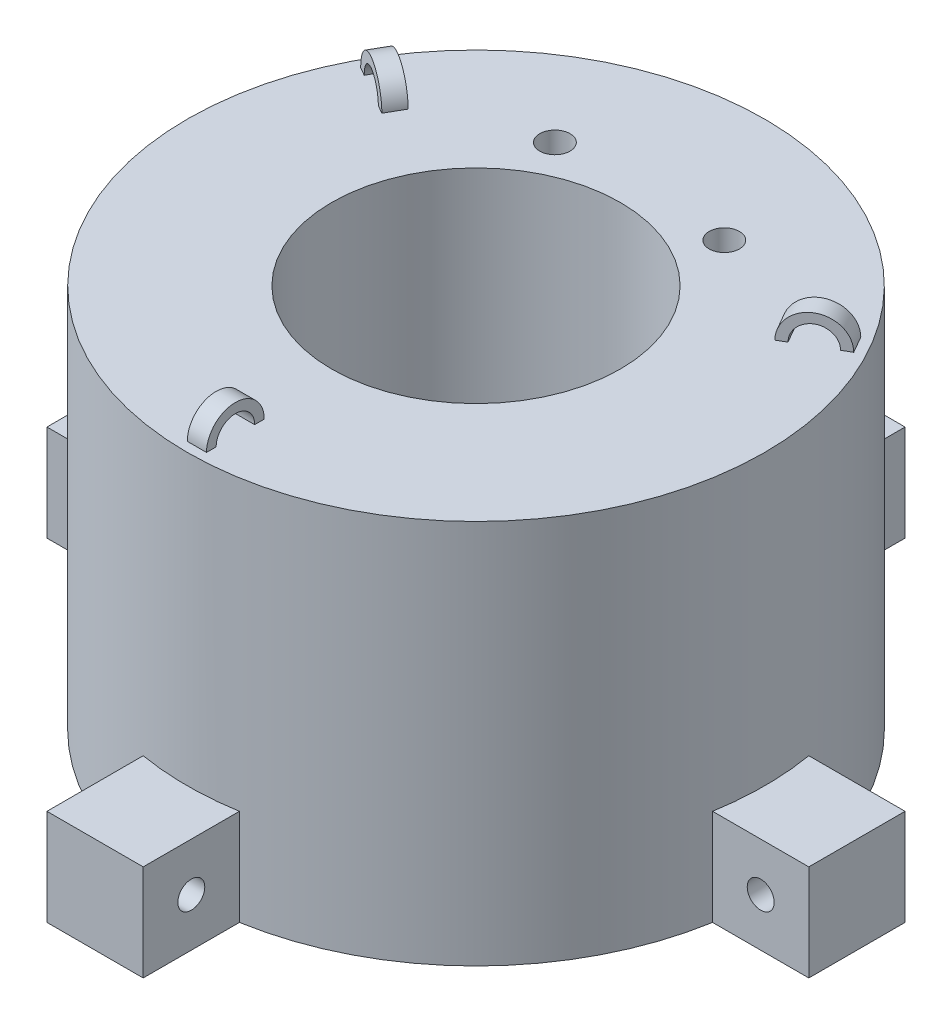
from build123d import *

# Parameters (mm, degrees)
SKETCH2_R           = 38.1
BOSS_EXTRUDE1_DEPTH = 50.8
SKETCH3_R           = 19.05
CUT_EXTRUDE1_DEPTH  = 76.2
BOSS_EXTRUDE2_DEPTH = 12.7
SKETCH5_R           = 1.778
CUT_EXTRUDE2_DEPTH  = 25.4
CIRPATTERN2_COUNT   = 4
SKETCH10_R          = 2
CUT_EXTRUDE4_DEPTH  = 12.7
BOSS_EXTRUDE5_DEPTH = 1.27
CIRPATTERN3_COUNT   = 3


with BuildPart() as part:
    # Sketch2 → Boss-Extrude1 (new body)
    with BuildSketch(Plane(origin=(0, 0, 0), x_dir=(1, 0, 0), z_dir=(0, 1, 0))):
        Circle(SKETCH2_R)
    extrude(amount=BOSS_EXTRUDE1_DEPTH)

    # Sketch3 → Cut-Extrude1 (cut)
    with BuildSketch(Plane(origin=(0, 50.8, 0), x_dir=(1, 0, 0), z_dir=(0, 1, 0))):
        Circle(SKETCH3_R)
    extrude(amount=-CUT_EXTRUDE1_DEPTH, mode=Mode.SUBTRACT)

    # Sketch4 → Boss-Extrude2 (add)
    with BuildSketch(Plane(origin=(0, 0, 0), x_dir=(1, 0, 0), z_dir=(0, 1, 0))):
        with BuildLine():
            Line((-50.267106623, 6.35), (-50.267106623, -6.35))
            Line((-50.267106623, -6.35), (-37.567106623, -6.35))
            ThreePointArc((-37.567106623, -6.35), (-38.1, 0), (-37.567106623, 6.35))
            Line((-37.567106623, 6.35), (-50.267106623, 6.35))
        make_face()
    boss_extrude2 = extrude(amount=BOSS_EXTRUDE2_DEPTH)

    # Sketch5 → Cut-Extrude2 (cut)
    with BuildSketch(Plane.XY.offset(6.35)):
        with Locations((-43.917106623, 6.35)):
            Circle(SKETCH5_R)
    cut_extrude2 = extrude(amount=-CUT_EXTRUDE2_DEPTH, mode=Mode.SUBTRACT)

    # CirPattern2: Boss-Extrude2, Cut-Extrude2 ×4 about axis
    cirpattern2_axis = Axis((0, 50.8, 0), (0, -1, 0))
    add([boss_extrude2.rotate(cirpattern2_axis, i * 360 / CIRPATTERN2_COUNT) for i in range(1, CIRPATTERN2_COUNT)])
    add([cut_extrude2.rotate(cirpattern2_axis, i * 360 / CIRPATTERN2_COUNT) for i in range(1, CIRPATTERN2_COUNT)], mode=Mode.SUBTRACT)

    # Sketch10 → Cut-Extrude4 (cut)
    with BuildSketch(Plane(origin=(0, 50.8, 0), x_dir=(1, 0, 0), z_dir=(0, 1, 0))):
        with Locations((11.176, 21.59)):
            Circle(SKETCH10_R)
    cut_extrude4 = extrude(amount=-CUT_EXTRUDE4_DEPTH, mode=Mode.SUBTRACT)

    # Mirror1: Cut-Extrude4 across plane
    add(cut_extrude4.mirror(Plane(origin=(0, 0, 0), x_dir=(0, 0, 1), z_dir=(1, 0, 0))), mode=Mode.SUBTRACT)

    # Sketch13 → Boss-Extrude5 (add, symmetric)
    with BuildSketch(Plane(origin=(0, 0, 0), x_dir=(0.8660254037844362, 0, -0.5000000000000043), z_dir=(0.5000000000000043, 0, 0.8660254037844362))):
        with BuildLine():
            Line((35.56, 50.8), (36.83, 50.8))
            ThreePointArc((36.83, 50.8), (33.02, 54.61), (29.21, 50.8))
            Line((29.21, 50.8), (30.48, 50.8))
            ThreePointArc((30.48, 50.8), (33.02, 53.34), (35.56, 50.8))
        make_face()
    boss_extrude5 = extrude(amount=BOSS_EXTRUDE5_DEPTH, both=True)

    # CirPattern3: Boss-Extrude5 ×3 about axis
    cirpattern3_axis = Axis((0, -25.4, 0), (0, 1, 0))
    for i in range(1, CIRPATTERN3_COUNT):
        add(boss_extrude5.rotate(cirpattern3_axis, i * 360 / CIRPATTERN3_COUNT))


solid = part.part
